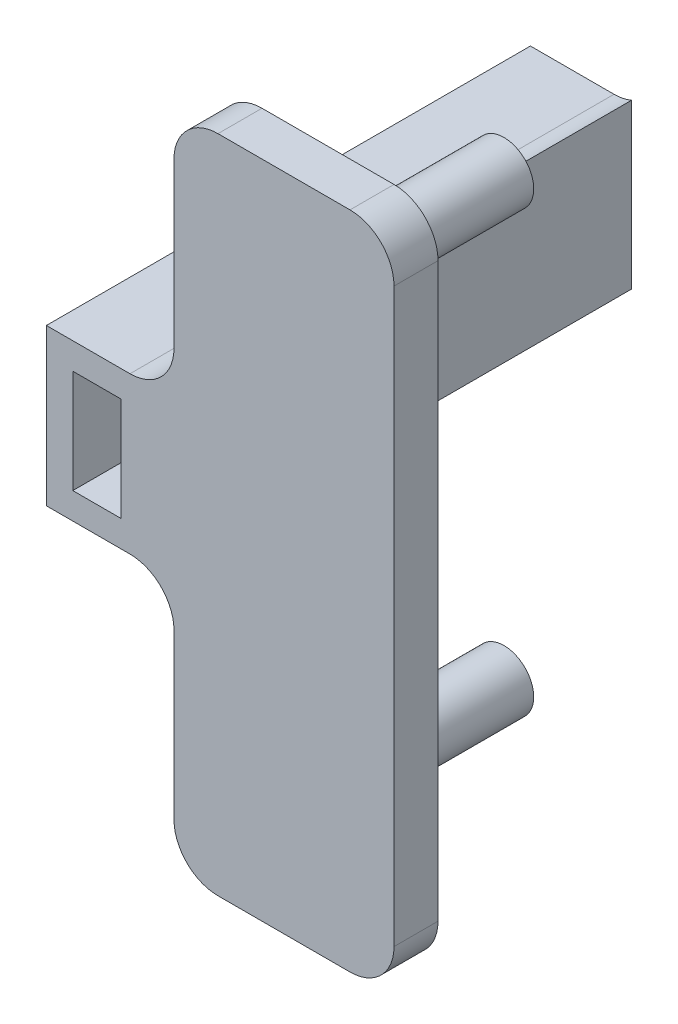
from build123d import *

# Parameters (mm, degrees)
SKETCH1_W           = 2.2
SKETCH1_H           = 4.7
BOSS_EXTRUDE1_DEPTH = 2
SKETCH2_W           = 4.6
SKETCH2_H           = 7.1
SKETCH2_W_2         = 2.2
SKETCH2_H_2         = 4.7
BOSS_EXTRUDE2_DEPTH = 20
SKETCH3_W           = 2.2
SKETCH3_H           = 4.7
BOSS_EXTRUDE3_DEPTH = 1
SKETCH5_R           = 1.35
BOSS_EXTRUDE4_DEPTH = 8
FILLET1_R           = 2
SKETCH6_W           = 1.9
SKETCH6_H           = 7.433939444
BOSS_EXTRUDE5_DEPTH = 8


with BuildPart() as part:
    # Sketch1 → Boss-Extrude1 (new body)
    with BuildSketch(Plane.XY):
        Polygon((49, 70), (39, 70), (39, 58.55), (33.2, 58.55), (33.2, 51.45), (39, 51.45), (39, 40), (49, 40), align=None)
        with Locations((35.5, 55)):
            Rectangle(SKETCH1_W, SKETCH1_H, mode=Mode.SUBTRACT)
    extrude(amount=BOSS_EXTRUDE1_DEPTH)

    # Sketch2 → Boss-Extrude2 (add)
    with BuildSketch(Plane(origin=(0, 0, 0), x_dir=(-1, 0, 0), z_dir=(0, 0, -1))):
        with Locations((-35.5, 55)):
            Rectangle(SKETCH2_W, SKETCH2_H)
        with Locations((-35.5, 55)):
            Rectangle(SKETCH2_W_2, SKETCH2_H_2, mode=Mode.SUBTRACT)
    extrude(amount=BOSS_EXTRUDE2_DEPTH)

    # Sketch3 → Boss-Extrude3 (add)
    with BuildSketch(Plane(origin=(0, 0, -20), x_dir=(-1, 0, 0), z_dir=(0, 0, -1))):
        with Locations((-35.5, 55)):
            Rectangle(SKETCH3_W, SKETCH3_H)
    extrude(amount=-BOSS_EXTRUDE3_DEPTH)

    # Sketch5 → Boss-Extrude4 (add)
    with BuildSketch(Plane(origin=(0, 0, 0), x_dir=(-1, 0, 0), z_dir=(0, 0, -1))):
        with Locations((-44, 45)):
            Circle(SKETCH5_R)
        with Locations((-44, 65)):
            Circle(SKETCH5_R)
    extrude(amount=BOSS_EXTRUDE4_DEPTH)

    # Fillet1
    fillet1_edges = [part.edges().sort_by_distance(p)[0] for p in [
        (49, 70, 1),
    ]]
    fillet(fillet1_edges, radius=FILLET1_R)
    fillet1_2_edges = [part.edges().sort_by_distance(p)[0] for p in [
        (39, 70, 1),
    ]]
    fillet(fillet1_2_edges, radius=FILLET1_R)
    fillet1_3_edges = [part.edges().sort_by_distance(p)[0] for p in [
        (49, 40, 1),
    ]]
    fillet(fillet1_3_edges, radius=FILLET1_R)
    fillet1_4_edges = [part.edges().sort_by_distance(p)[0] for p in [
        (39, 58.55, 1),
    ]]
    fillet(fillet1_4_edges, radius=FILLET1_R)
    fillet1_5_edges = [part.edges().sort_by_distance(p)[0] for p in [
        (39, 40, 1),
    ]]
    fillet(fillet1_5_edges, radius=FILLET1_R)
    fillet1_6_edges = [part.edges().sort_by_distance(p)[0] for p in [
        (39, 51.45, 1),
    ]]
    fillet(fillet1_6_edges, radius=FILLET1_R)

    # Sketch6 → Boss-Extrude5 (add)
    with BuildSketch(Plane(origin=(0, 0, 0), x_dir=(-1, 0, 0), z_dir=(0, 0, -1))):
        with Locations((-38.75, 55)):
            Rectangle(SKETCH6_W, SKETCH6_H)
    extrude(amount=BOSS_EXTRUDE5_DEPTH)


solid = part.part
